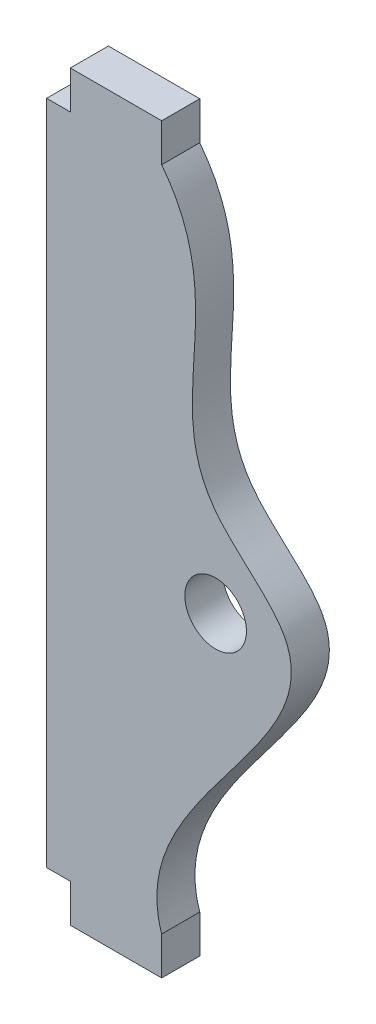
from build123d import *

# Parameters (mm, degrees)
CROQUIS1_R              = 1.618326578
SALIENTE_EXTRUIR1_DEPTH = 2


with BuildPart() as part:
    # Croquis1 → Saliente-Extruir1 (new body)
    with BuildSketch(Plane.XY):
        with BuildLine():
            Line((-2.3, 15.5), (-3.542279833, 15.5))
            Line((-3.542279833, 15.5), (-3.542279833, -19.5))
            Line((-3.542279833, -19.5), (-2.3, -19.5))
            Line((-2.3, -19.5), (-2.3, -21.5))
            Line((-2.3, -21.5), (2.5, -21.5))
            Line((2.5, -21.5), (2.5, -19.5))
            add(Edge.make_bspline(
                [(2.5, 15.5), (6.281303379, 10.613419726), (1.020664146, 3.225624843), (14.716042486, -5.529637834), (0.453912855, -13.380168108), (2.5, -19.5)],
                knots=[0, 0, 0, 0, 0.382800514, 0.518824947, 1, 1, 1, 1], degree=3))
            Line((2.5, 15.5), (2.5, 17.5))
            Line((2.5, 17.5), (-2.3, 17.5))
            Line((-2.3, 17.5), (-2.3, 15.5))
        make_face()
        with Locations((5.33433609, -3.499575471)):
            Circle(CROQUIS1_R, mode=Mode.SUBTRACT)
    extrude(amount=SALIENTE_EXTRUIR1_DEPTH)


solid = part.part
